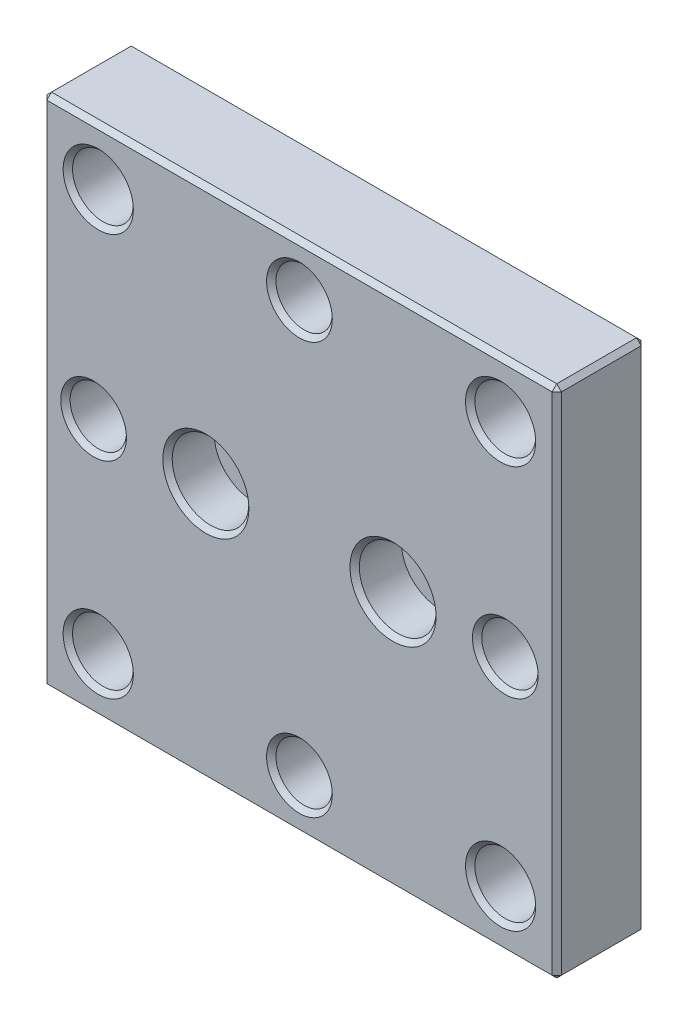
from build123d import *

# Parameters (mm, degrees)
SKETCH1_W           = 55
SKETCH1_H           = 55
SKETCH1_R           = 4.1
BOSS_EXTRUDE1_DEPTH = 9.525
SKETCH1_3_R         = 4.1
SKETCH1_3_R_2       = 2.2
BOSS_EXTRUDE2_DEPTH = 4.525
SKETCH3_R           = 3.0127
CUT_EXTRUDE1_DEPTH  = 79.362782142
SKETCH5_R           = 3.2512
CUT_EXTRUDE2_DEPTH  = 6.4008
CHAMFER1_SIZE       = 0.5
SKETCH6_R           = 1.25
CUT_EXTRUDE3_DEPTH  = 79.362782142
CHAMFER2_SIZE       = 0.5


with BuildPart() as part:
    # Sketch1 → Boss-Extrude1 (new body)
    with BuildSketch(Plane.XY):
        with Locations((27.5, 27.5)):
            Rectangle(SKETCH1_W, SKETCH1_H)
        with Locations((17.5, 27.5)):
            Circle(SKETCH1_R, mode=Mode.SUBTRACT)
        with Locations((37.5, 27.5)):
            Circle(SKETCH1_R, mode=Mode.SUBTRACT)
    extrude(amount=BOSS_EXTRUDE1_DEPTH)

    # Sketch1<3> → Boss-Extrude2 (add)
    # profile 1 of 2: a face of its own
    with BuildSketch(Plane.XY):
        with Locations((17.5, 27.5)):
            Circle(SKETCH1_3_R)
        with Locations((17.5, 27.5)):
            Circle(SKETCH1_3_R_2, mode=Mode.SUBTRACT)
    # profile 2 of 2: a face of its own
    with BuildSketch(Plane.XY):
        with Locations((37.5, 27.5)):
            Circle(SKETCH1_3_R)
        with Locations((37.5, 27.5)):
            Circle(SKETCH1_3_R_2, mode=Mode.SUBTRACT)
    extrude(amount=BOSS_EXTRUDE2_DEPTH)

    # Sketch3 → Cut-Extrude1 (cut, through all)
    with BuildSketch(Plane.XY.offset(9.525)):
        with Locations((27.5, 49.5)):
            Circle(SKETCH3_R)
        with Locations((5.5, 27.5)):
            Circle(SKETCH3_R)
        with Locations((49.5, 27.5)):
            Circle(SKETCH3_R)
        with Locations((27.5, 5.5)):
            Circle(SKETCH3_R)
    extrude(amount=-CUT_EXTRUDE1_DEPTH, mode=Mode.SUBTRACT)

    # Sketch5 → Cut-Extrude2 (cut)
    with BuildSketch(Plane.XY.offset(9.525)):
        with Locations((6, 49)):
            Circle(SKETCH5_R)
        with Locations((49, 49)):
            Circle(SKETCH5_R)
        with Locations((49, 6)):
            Circle(SKETCH5_R)
        with Locations((6, 6)):
            Circle(SKETCH5_R)
    extrude(amount=-CUT_EXTRUDE2_DEPTH, mode=Mode.SUBTRACT)

    # Chamfer1
    chamfer1_edges = [part.edges().sort_by_distance(p)[0] for p in [
        (46.4873, 27.5, 0),
        (35.3, 27.5, 0),
        (24.4873, 49.5, 0),
        (24.4873, 5.5, 0),
        (15.3, 27.5, 0),
        (2.4873, 27.5, 0),
        (2.7488, 49, 9.525),
        (2.7488, 6, 9.525),
        (2.4873, 27.5, 9.525),
        (13.4, 27.5, 9.525),
        (33.4, 27.5, 9.525),
        (24.4873, 5.5, 9.525),
        (45.7488, 6, 9.525),
        (46.4873, 27.5, 9.525),
        (45.7488, 49, 9.525),
        (24.4873, 49.5, 9.525),
        (27.5, 55, 0),
        (55, 55, 4.7625),
        (55, 27.5, 0),
        (55, 0, 4.7625),
        (27.5, 0, 0),
        (0, 27.5, 0),
        (0, 55, 4.7625),
        (0, 0, 4.7625),
        (55, 27.5, 9.525),
        (27.5, 0, 9.525),
        (0, 27.5, 9.525),
        (27.5, 55, 9.525),
    ]]
    chamfer(chamfer1_edges, length=CHAMFER1_SIZE)

    # Sketch6 → Cut-Extrude3 (cut, through all)
    with BuildSketch(Plane.XY.offset(9.525)):
        with Locations((6, 49)):
            Circle(SKETCH6_R)
        with Locations((49, 49)):
            Circle(SKETCH6_R)
        with Locations((49, 6)):
            Circle(SKETCH6_R)
        with Locations((6, 6)):
            Circle(SKETCH6_R)
    extrude(amount=-CUT_EXTRUDE3_DEPTH, mode=Mode.SUBTRACT)

    # Chamfer2
    chamfer2_edges = [part.edges().sort_by_distance(p)[0] for p in [
        (4.75, 6, 3.1242),
        (47.75, 6, 3.1242),
        (47.75, 49, 3.1242),
        (4.75, 49, 3.1242),
        (4.75, 49, 0),
        (47.75, 49, 0),
        (47.75, 6, 0),
        (4.75, 6, 0),
    ]]
    chamfer(chamfer2_edges, length=CHAMFER2_SIZE)


solid = part.part
